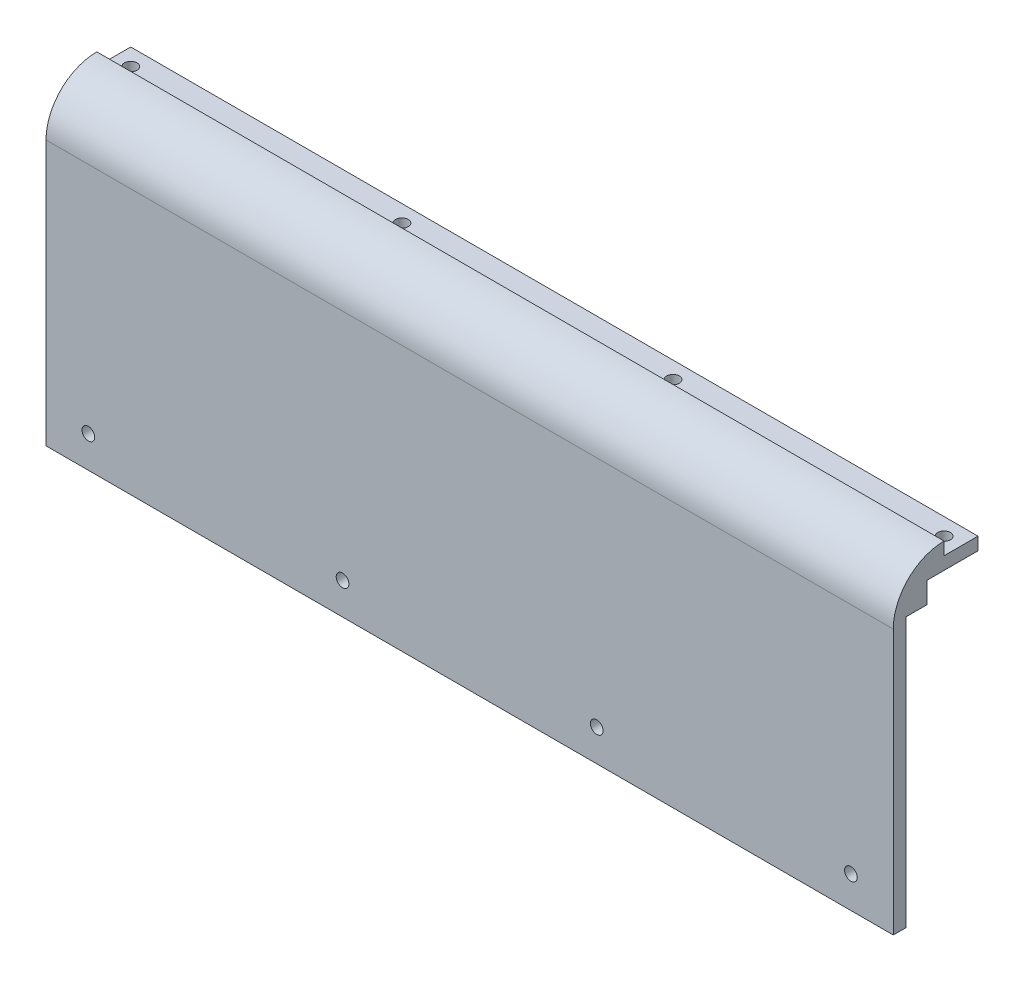
from build123d import *

# Parameters (mm, degrees)
SKETCH1_W           = 200
SKETCH1_H           = 20
BOSS_EXTRUDE1_DEPTH = 3
CUT_EXTRUDE1_REACH  = 102.544
SKETCH2_R           = 1.5
LPATTERN1_COUNT     = 4
LPATTERN1_PITCH     = 64
SKETCH3_W           = 200
SKETCH3_H           = 3
BOSS_EXTRUDE2_DEPTH = 68.54
SKETCH4_W           = 200
SKETCH4_H           = 5
BOSS_EXTRUDE3_DEPTH = 5
SKETCH5_W           = 200
SKETCH5_H           = 12
BOSS_EXTRUDE4_DEPTH = 3
FILLET4_R           = 12
SKETCH6_W           = 3
SKETCH6_H           = 63.54
BOSS_EXTRUDE5_DEPTH = 20
CUT_EXTRUDE2_REACH  = 213.818
SKETCH7_R           = 1.5
CUT_EXTRUDE3_REACH  = 125.397
SKETCH8_R           = 1.5
LPATTERN2_COUNT     = 4
LPATTERN2_PITCH     = 60


with BuildPart() as part:
    # Sketch1 → Boss-Extrude1 (new body)
    with BuildSketch(Plane(origin=(0, 0, 0), x_dir=(1, 0, 0), z_dir=(0, 1, 0))):
        Rectangle(SKETCH1_W, SKETCH1_H)
    extrude(amount=BOSS_EXTRUDE1_DEPTH)

    # Sketch2 → Cut-Extrude1 (cut, up to next)
    with BuildSketch(Plane(origin=(0, 3, 0), x_dir=(1, 0, 0), z_dir=(0, 1, 0)), mode=Mode.PRIVATE) as cut_extrude1_sk1:
        with Locations(Location((-96, 6, 0), (0, 0, 270))):
            Circle(SKETCH2_R)
    cut_extrude1_tool1 = extrude(cut_extrude1_sk1.sketch, amount=-CUT_EXTRUDE1_REACH, mode=Mode.PRIVATE) & part.part
    cut_extrude1 = cut_extrude1_tool1.solids().sort_by_distance((-96, 3, -6))[0]
    add(cut_extrude1, mode=Mode.SUBTRACT)

    # LPattern1: Cut-Extrude1 ×4
    with Locations(*[(i * LPATTERN1_PITCH, 0, 0) for i in range(1, LPATTERN1_COUNT)]):
        add(cut_extrude1, mode=Mode.SUBTRACT)

    # Sketch3 → Boss-Extrude2 (add)
    with BuildSketch(Plane.XZ):
        with Locations((0, 8.5)):
            Rectangle(SKETCH3_W, SKETCH3_H)
    extrude(amount=BOSS_EXTRUDE2_DEPTH)

    # Sketch4 → Boss-Extrude3 (add)
    with BuildSketch(Plane(origin=(0, 0, 7), x_dir=(-1, 0, 0), z_dir=(0, 0, -1))):
        with Locations((0, -2.5)):
            Rectangle(SKETCH4_W, SKETCH4_H)
    extrude(amount=BOSS_EXTRUDE3_DEPTH)

    # Sketch5 → Boss-Extrude4 (add)
    with BuildSketch(Plane(origin=(0, 3, 0), x_dir=(1, 0, 0), z_dir=(0, 1, 0))):
        with Locations((0, -4)):
            Rectangle(SKETCH5_W, SKETCH5_H)
    extrude(amount=BOSS_EXTRUDE4_DEPTH)

    # Fillet4
    fillet4_edges = [part.edges().sort_by_distance(p)[0] for p in [
        (0, 6, 10),
    ]]
    fillet(fillet4_edges, radius=FILLET4_R - 0.0001)  # a hair under: the kernel refuses the full size

    # Sketch6 → Boss-Extrude5 (add)
    with BuildSketch(Plane(origin=(0, 0, 7), x_dir=(-1, 0, 0), z_dir=(0, 0, -1))):
        with Locations((98.5, -36.77)):
            Rectangle(SKETCH6_W, SKETCH6_H)
    extrude(amount=BOSS_EXTRUDE5_DEPTH)

    # Sketch7 → Cut-Extrude2 (cut, up to next)
    with BuildSketch(Plane.ZY.offset(100), mode=Mode.PRIVATE) as cut_extrude2_sk1:
        with Locations((-5, -10.27)):
            Circle(SKETCH7_R)
    cut_extrude2_tool1 = extrude(cut_extrude2_sk1.sketch, amount=-CUT_EXTRUDE2_REACH, mode=Mode.PRIVATE) & part.part
    # Sketch7 → Cut-Extrude2 (cut, up to next)
    with BuildSketch(Plane.ZY.offset(100), mode=Mode.PRIVATE) as cut_extrude2_sk2:
        with Locations((-5, -55.27)):
            Circle(SKETCH7_R)
    cut_extrude2_tool2 = extrude(cut_extrude2_sk2.sketch, amount=-CUT_EXTRUDE2_REACH, mode=Mode.PRIVATE) & part.part
    add(cut_extrude2_tool1.solids().sort_by_distance((-100, -10.27, -5))[0], mode=Mode.SUBTRACT)
    add(cut_extrude2_tool2.solids().sort_by_distance((-100, -55.27, -5))[0], mode=Mode.SUBTRACT)

    # Sketch8 → Cut-Extrude3 (cut, up to next)
    with BuildSketch(Plane.XY.offset(10), mode=Mode.PRIVATE) as cut_extrude3_sk1:
        with Locations((-90, -61.04)):
            Circle(SKETCH8_R)
    cut_extrude3_tool1 = extrude(cut_extrude3_sk1.sketch, amount=-CUT_EXTRUDE3_REACH, mode=Mode.PRIVATE) & part.part
    cut_extrude3 = cut_extrude3_tool1.solids().sort_by_distance((-90, -61.04, 10))[0]
    add(cut_extrude3, mode=Mode.SUBTRACT)

    # LPattern2: Cut-Extrude3 ×4
    with Locations(*[(i * LPATTERN2_PITCH, 0, 0) for i in range(1, LPATTERN2_COUNT)]):
        add(cut_extrude3, mode=Mode.SUBTRACT)


solid = part.part
